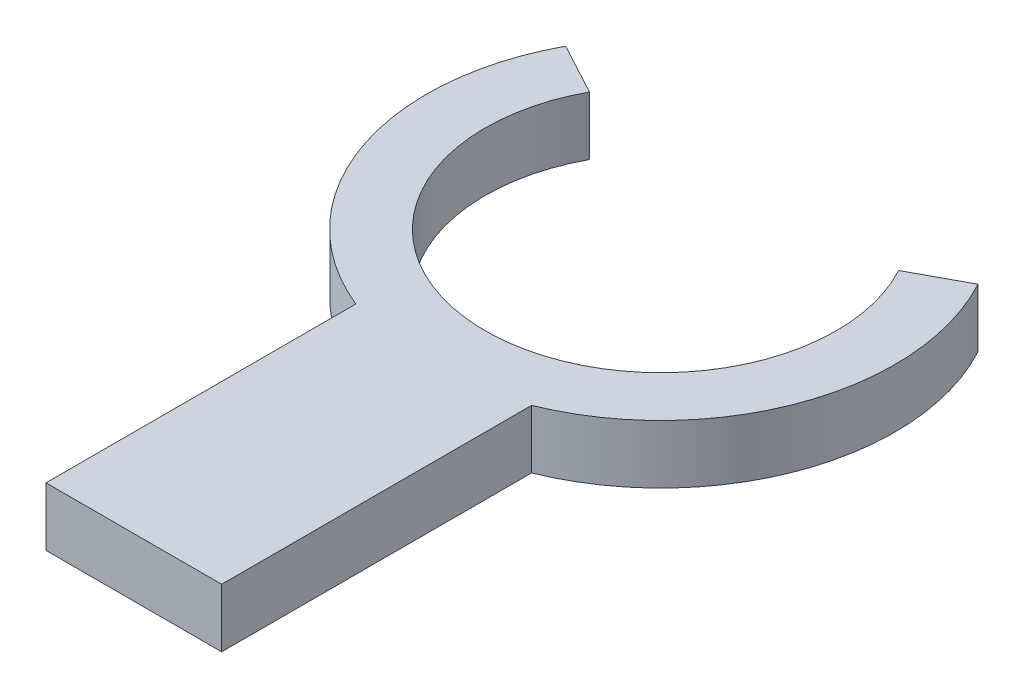
from build123d import *

# Parameters (mm, degrees)
BOSS_EXTRUDE1_DEPTH = 10


with BuildPart() as part:
    # Sketch1 → Boss-Extrude1 (new body)
    with BuildSketch(Plane(origin=(0, 0, 0), x_dir=(1, 0, 0), z_dir=(0, 1, 0))):
        with BuildLine():
            ThreePointArc((-35.213957173, 18.973065652), (-37.626936939, -13.572531695), (-14.993584275, -37.083587078))
            Line((-14.993584275, -37.083587078), (-15, -90))
            Line((-15, -90), (15, -90))
            Line((15, -90), (15.006416354, -37.078396247))
            ThreePointArc((15.006416354, -37.078396247), (37.6292848, -13.566020989), (35.213957173, 18.973065652))
            Line((35.213957173, 18.973065652), (26.41046788, 14.229799239))
            ThreePointArc((26.41046788, 14.229799239), (0, -30), (-26.41046788, 14.229799239))
            Line((-26.41046788, 14.229799239), (-35.213957173, 18.973065652))
        make_face()
    extrude(amount=BOSS_EXTRUDE1_DEPTH)


solid = part.part
